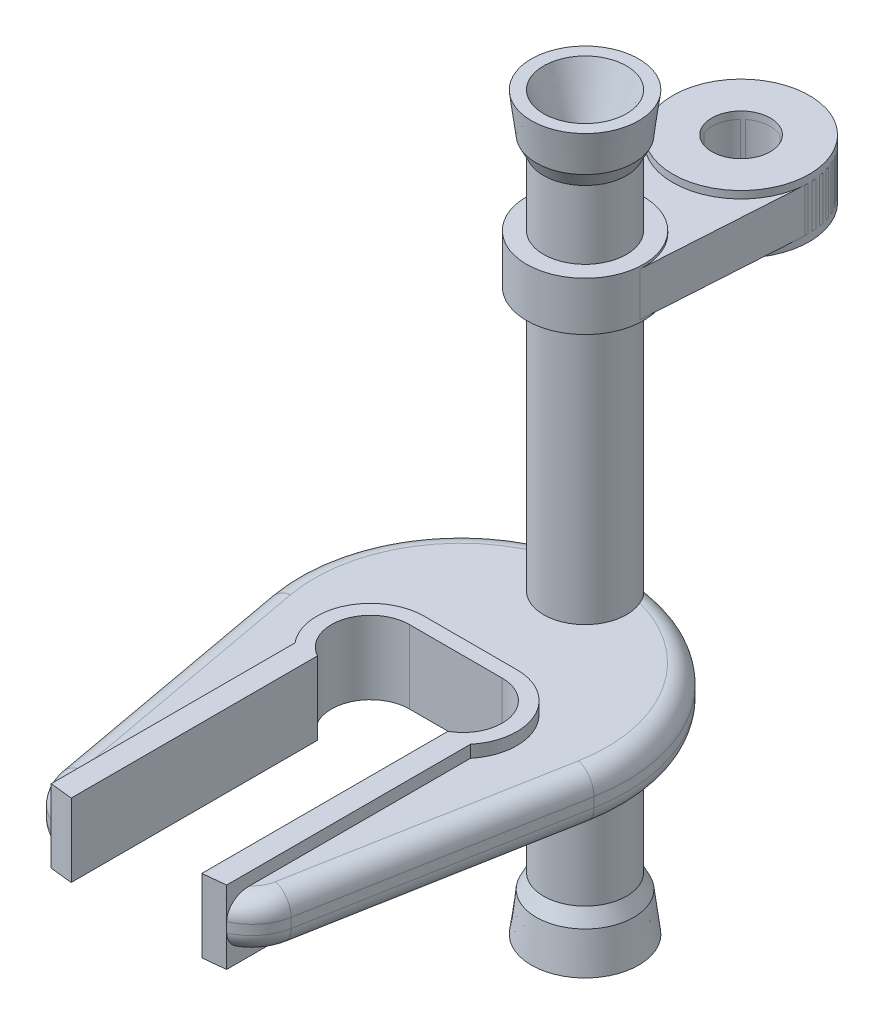
from build123d import *

# Parameters (mm, degrees)
CROQUIS2_R                   = 5
CROQUIS1_R                   = 5.5
CROQUIS2_2_R                 = 5
CROQUIS3_R                   = 4.25
CROQUIS3_2_R                 = 4.25
SALIENTE_EXTRUIR1_DEPTH      = 64
SALIENTE_EXTRUIR2_DEPTH      = 2.5
SALIENTE_EXTRUIR2_DEPTH_BACK = 2.5
REDONDEO1_R                  = 5
REDONDEO2_R                  = 5
REDONDEO3_R                  = 2
REDONDEO4_R                  = 2
SALIENTE_EXTRUIR3_DEPTH      = 3.75
SALIENTE_EXTRUIR3_DEPTH_BACK = 3.75
SALIENTE_EXTRUIR4_DEPTH      = 3
SALIENTE_EXTRUIR4_DEPTH_BACK = 3
CROQUIS9_R                   = 7
SALIENTE_EXTRUIR5_DEPTH      = 2.25
SALIENTE_EXTRUIR5_DEPTH_BACK = 2.25
SALIENTE_EXTRUIR6_DEPTH      = 2.5
SALIENTE_EXTRUIR6_DEPTH_BACK = 2.5
CROQUIS8_R                   = 6
CORTAR_EXTRUIR1_START        = -6
CROQUIS11_R                  = 3
CORTAR_EXTRUIR1_DEPTH        = 6


with BuildPart() as part:
    # Croquis2 → Recubrir1 section 0
    with BuildSketch(Plane(origin=(0, 4, 0), x_dir=(1, 0, 0), z_dir=(0, 1, 0))):
        with Locations((-17.693226, 1.412135)):
            Circle(CROQUIS2_R)
    # Croquis1 → Recubrir1 section 1
    with BuildSketch(Plane(origin=(0, 0, 0), x_dir=(1, 0, 0), z_dir=(0, 1, 0))):
        with Locations((-17.693226, 1.412135)):
            Circle(CROQUIS1_R)
    recubrir1 = loft()

    # Croquis2<2> → Recubrir3 section 0
    with BuildSketch(Plane(origin=(0, 4, 0), x_dir=(1, 0, 0), z_dir=(0, 1, 0))):
        with Locations((-17.693226, 1.412135)):
            Circle(CROQUIS2_2_R)
    # Croquis3 → Recubrir3 section 1
    with BuildSketch(Plane(origin=(0, 5.5, 0), x_dir=(1, 0, 0), z_dir=(0, 1, 0))):
        with Locations((-17.693226, 1.412135)):
            Circle(CROQUIS3_R)
    recubrir3 = loft()

    # Croquis3<2> → Saliente-Extruir1 (add)
    with BuildSketch(Plane(origin=(0, 5.5, 0), x_dir=(1, 0, 0), z_dir=(0, 1, 0))):
        with Locations(Location((-17.693226, 1.412135, 0), (0, 0, 270))):
            Circle(CROQUIS3_2_R)
    extrude(amount=SALIENTE_EXTRUIR1_DEPTH)

    # Simetría1: Recubrir3 across plane
    add(recubrir3.mirror(Plane.ZX.offset(37.5)))

    # Simetría2: Recubrir1 across plane
    add(recubrir1.mirror(Plane.ZX.offset(37.5)))

    # Cortar-Recubrir1: read off the stored shape, not the designer's step
    # Cortar-Recubrir1: loft between two sections, ruled curve by curve
    cortar_recubrir1_from = [
        Edge.make_bspline([(-17.9674, 67, -0.192575), (-15.528278, 67, 0.355773), (-14.97993, 67, -2.083348), (-17.419052, 67, -2.631696), (-19.858173, 67, -3.180044), (-20.406521, 67, -0.740923), (-17.9674, 67, -0.192575)], [0, 0, 0, 0, 0.5, 0.5, 0.5, 1, 1, 1, 1], 3, [1, 0.333333, 0.333333, 1, 0.333333, 0.333333, 1]),
    ]
    cortar_recubrir1_to = [
        Edge.make_bspline([(-17.693226, 75, 2.837865), (-9.193226, 75, 2.837865), (-9.193226, 75, -5.662135), (-17.693226, 75, -5.662135), (-26.193226, 75, -5.662135), (-26.193226, 75, 2.837865), (-17.693226, 75, 2.837865)], [0, 0, 0, 0, 0.5, 0.5, 0.5, 1, 1, 1, 1], 3, [1, 0.333333, 0.333333, 1, 0.333333, 0.333333, 1]),
    ]
    cortar_recubrir1 = Solid(Shell([*[Face.make_surface_from_curves(cortar_recubrir1_from[k], cortar_recubrir1_to[k]) for k in range(1)], Face(Wire(cortar_recubrir1_from)), Face(Wire(cortar_recubrir1_to))]))
    add(cortar_recubrir1, mode=Mode.SUBTRACT)

    # Simetría3: Cortar-Recubrir1 across plane
    add(cortar_recubrir1.mirror(Plane.ZX.offset(37.5)), mode=Mode.SUBTRACT)


with BuildPart() as body_2:
    # Croquis5 → Saliente-Extruir2 (new, two sides: drawn at the far end of the back side and taken through both)
    with BuildSketch(Plane(origin=(0, 28, 0), x_dir=(1, 0, 0), z_dir=(0, 1, 0)).offset(-SALIENTE_EXTRUIR2_DEPTH_BACK)):
        with BuildLine():
            Line((-0.970266, -14.394431), (-6.443226, -44.337865))
            Line((-6.443226, -44.337865), (-8.693226, -44.337865))
            Line((-8.693226, -44.337865), (-8.693226, -19.337865))
            ThreePointArc((-8.693226, -19.337865), (-7.960929, -13.492657), (-12.935866, -10.337865))
            Line((-12.935866, -10.337865), (-22.450585, -10.337865))
            ThreePointArc((-22.450585, -10.337865), (-27.425522, -13.492657), (-26.693226, -19.337865))
            Line((-26.693226, -19.337865), (-26.693226, -44.337865))
            Line((-26.693226, -44.337865), (-28.943226, -44.337865))
            Line((-28.943226, -44.337865), (-34.416186, -14.394431))
            ThreePointArc((-34.416186, -14.394431), (-17.693226, 5.662135), (-0.970266, -14.394431))
        make_face()
    extrude(amount=SALIENTE_EXTRUIR2_DEPTH + SALIENTE_EXTRUIR2_DEPTH_BACK)

    # Redondeo1
    # the kernel refuses this fillet: 5 mm, written as the material it takes off along each edge
    with BuildSketch(Plane(origin=(-6.443226, 39.867246, 44.337865), x_dir=(0.1797980334285227, 0, -0.9837035463874448), z_dir=(0, -1, 0))) as redondeo1_piece_1:
        with BuildLine():
            CenterArc((3.746898, -5), REDONDEO1_R, 90, 56.128415)
            Line((-0.404546, -2.213333), (-0.487574, -2.1576))
            ThreePointArc((-0.487574, -2.1576), (-0.300643, -1.088687), (-0.09837, 0.01798))
            Line((-0.09837, 0.01798), (0, 0.1))
            Line((0, 0.1), (3.746898, 0.1))
            Line((3.746898, 0.1), (3.746898, 0))
        make_face()
    extrude(amount=23.734492, mode=Mode.SUBTRACT)

    # Redondeo2
    # the kernel refuses this fillet: 5 mm, written as the material it takes off along each edge
    with BuildSketch(Plane(origin=(-28.943226, 16.132754, 44.337865), x_dir=(-0.17979803342852285, 0, -0.9837035463874448), z_dir=(0, 1, 0))) as redondeo2_piece_1:
        with BuildLine():
            CenterArc((3.746898, -5), REDONDEO2_R, 90, 56.128415)
            Line((-0.404546, -2.213333), (-0.487574, -2.1576))
            ThreePointArc((-0.487574, -2.1576), (-0.300643, -1.088687), (-0.09837, 0.01798))
            Line((-0.09837, 0.01798), (0, 0.1))
            Line((0, 0.1), (3.746898, 0.1))
            Line((3.746898, 0.1), (3.746898, 0))
        make_face()
    extrude(amount=23.734492, mode=Mode.SUBTRACT)

    # Redondeo3
    redondeo3_edges = [body_2.edges().sort_by_distance(p)[0] for p in [
        (-17.693226, 30.5, -5.662135),
        (-32.016548, 30.5, 27.523229),
        (-3.369903, 30.5, 27.523229),
        (-6.770795, 30.5, 42.860294),
        (-28.615656, 30.5, 42.860294),
    ]]
    fillet(redondeo3_edges, radius=REDONDEO3_R)

    # Redondeo4
    redondeo4_edges = [body_2.edges().sort_by_distance(p)[0] for p in [
        (-17.693226, 25.5, -5.662135),
        (-3.369903, 25.5, 27.523229),
        (-6.770795, 25.5, 42.860294),
        (-28.615656, 25.5, 42.860294),
        (-32.016548, 25.5, 27.523229),
    ]]
    fillet(redondeo4_edges, radius=REDONDEO4_R)


with BuildPart() as body_3:
    # Croquis6 → Saliente-Extruir3 (new, two sides: drawn at the far end of the back side and taken through both)
    with BuildSketch(Plane(origin=(0, 28, 0), x_dir=(1, 0, 0), z_dir=(0, 1, 0)).offset(-SALIENTE_EXTRUIR3_DEPTH_BACK)):
        with BuildLine():
            Line((-22.450585, -11.837865), (-12.935866, -11.837865))
            ThreePointArc((-12.935866, -11.837865), (-9.062883, -14.837865), (-10.999375, -19.337865))
            Line((-10.999375, -19.337865), (-10.999375, -44.583261))
            ThreePointArc((-10.999375, -44.583261), (-9.845341, -44.469577), (-8.693226, -44.337865))
            Line((-8.693226, -44.337865), (-8.693226, -19.337865))
            ThreePointArc((-8.693226, -19.337865), (-7.960929, -13.492657), (-12.935866, -10.337865))
            Line((-12.935866, -10.337865), (-22.450585, -10.337865))
            ThreePointArc((-22.450585, -10.337865), (-27.425522, -13.492657), (-26.693226, -19.337865))
            Line((-26.693226, -19.337865), (-26.693226, -44.337865))
            ThreePointArc((-26.693226, -44.337865), (-25.541111, -44.469577), (-24.387077, -44.583261))
            Line((-24.387077, -44.583261), (-24.387077, -19.337865))
            ThreePointArc((-24.387077, -19.337865), (-26.323568, -14.837865), (-22.450585, -11.837865))
        make_face()
    extrude(amount=SALIENTE_EXTRUIR3_DEPTH + SALIENTE_EXTRUIR3_DEPTH_BACK)


with BuildPart() as body_4:
    # Croquis9 → Saliente-Extruir4 (new, two sides: drawn at the far end of the back side and taken through both)
    with BuildSketch(Plane(origin=(0, 60, 0), x_dir=(1, 0, 0), z_dir=(0, 1, 0)).offset(-SALIENTE_EXTRUIR4_DEPTH_BACK)):
        with Locations(Location((-17.693226, 17.412135, 0), (0, 0, 270))):
            Circle(CROQUIS9_R)
    extrude(amount=SALIENTE_EXTRUIR4_DEPTH + SALIENTE_EXTRUIR4_DEPTH_BACK)


with BuildPart() as body_5:
    # Croquis7 → Saliente-Extruir5 (new, two sides: drawn at the far end of the back side and taken through both)
    with BuildSketch(Plane(origin=(0, 60, 0), x_dir=(1, 0, 0), z_dir=(0, 1, 0)).offset(-SALIENTE_EXTRUIR5_DEPTH_BACK)):
        with BuildLine():
            Line((-23.681496, 1.037135), (-24.679541, 16.974635))
            ThreePointArc((-24.679541, 16.974635), (-17.693226, 24.412135), (-10.706911, 16.974635))
            Line((-10.706911, 16.974635), (-11.704956, 1.037135))
            ThreePointArc((-11.704956, 1.037135), (-17.693226, -4.587865), (-23.681496, 1.037135))
        make_face()
    extrude(amount=SALIENTE_EXTRUIR5_DEPTH + SALIENTE_EXTRUIR5_DEPTH_BACK)

    # Croquis8 → Saliente-Extruir6 (add, two sides: drawn at the far end of the back side and taken through both)
    with BuildSketch(Plane(origin=(0, 60, 0), x_dir=(1, 0, 0), z_dir=(0, 1, 0)).offset(-SALIENTE_EXTRUIR6_DEPTH_BACK)):
        with Locations(Location((-17.693226, 1.412135, 0), (0, 0, 270))):
            Circle(CROQUIS8_R)
    extrude(amount=SALIENTE_EXTRUIR6_DEPTH + SALIENTE_EXTRUIR6_DEPTH_BACK)


with BuildPart() as cortar_extruir1_tool:
    # Croquis11 → Cortar-Extruir1 (new body)
    with BuildSketch(Plane(origin=(0, 63, 0), x_dir=(1, 0, 0), z_dir=(0, 1, 0)).offset(CORTAR_EXTRUIR1_START)):
        with Locations(Location((-17.693226, 17.412135, 0), (0, 0, 270))):
            Circle(CROQUIS11_R)
    extrude(amount=CORTAR_EXTRUIR1_DEPTH)


with BuildPart() as body_4_1:
    add(body_4.part)

    # Cortar-Extruir1: cut by cortar_extruir1_tool
    add(cortar_extruir1_tool.part, mode=Mode.SUBTRACT)


with BuildPart() as body_5_1:
    add(body_5.part)

    # Cortar-Extruir1: cut by cortar_extruir1_tool
    add(cortar_extruir1_tool.part, mode=Mode.SUBTRACT)


solid = Compound([part.part, body_2.part, body_3.part, body_4_1.part, body_5_1.part])
